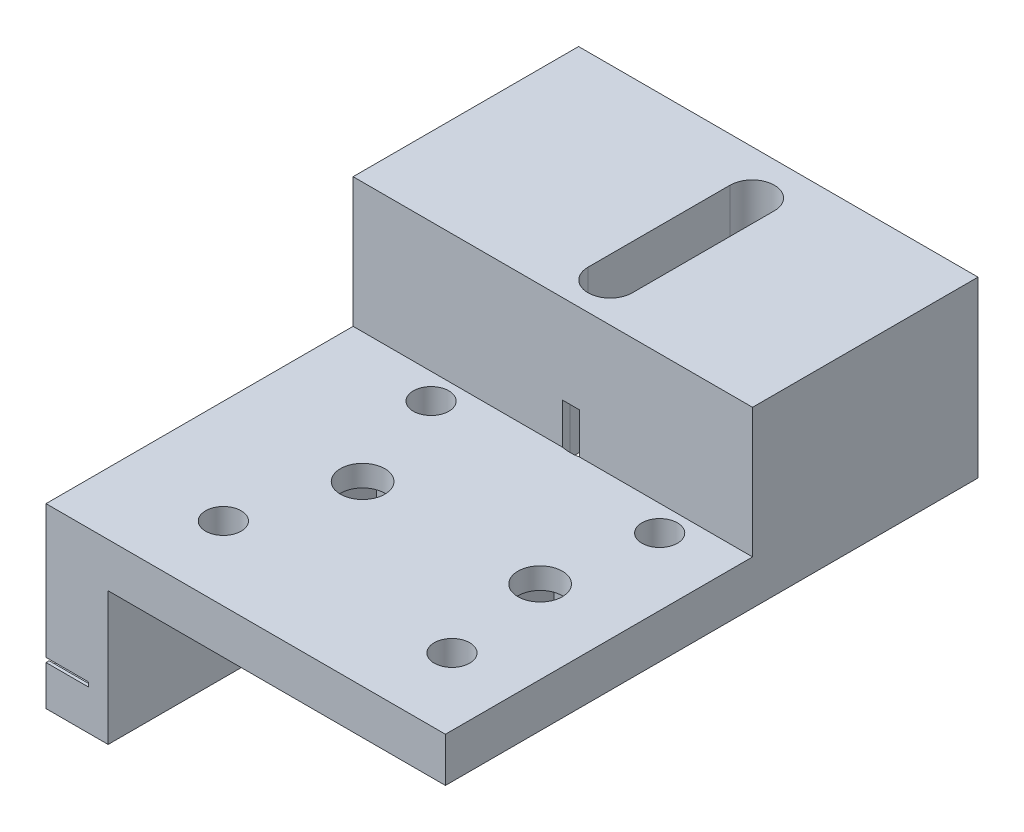
from build123d import *

# Parameters (mm, degrees)
BOSS_EXTRUDE1_DEPTH = 50.8
SKETCH2_R           = 2.54
CUT_EXTRUDE1_DEPTH  = 6.35
CUT_EXTRUDE5_DEPTH  = 3.302
SKETCH5_R           = 3.175
CUT_EXTRUDE6_DEPTH  = 79.801427652
CUT_EXTRUDE7_DEPTH  = 6.096
CRVPATTERN1_DEPTH   = 6.096
CUT_EXTRUDE8_DEPTH  = 6.096
BOSS_EXTRUDE2_DEPTH = 25.4
SKETCH16_W          = 57.15
SKETCH16_H          = 18.542
BOSS_EXTRUDE4_DEPTH = 6.858
BOSS_EXTRUDE5_DEPTH = 8.89
CUT_EXTRUDE9_DEPTH  = 81.413768498
CUT_EXTRUDE10_DEPTH = 12.192


# Read off the part's stored shape, not the designer's step: CrvPattern1
with BuildPart() as part:
    # Sketch1 → Boss-Extrude1 (new body)
    with BuildSketch(Plane.XY):
        Polygon((8.89, -6.35), (57.15, -6.35), (57.15, 0), (0, 0), (0, -25.4), (8.89, -25.4), align=None)
    extrude(amount=BOSS_EXTRUDE1_DEPTH)

    # Sketch2 → Cut-Extrude1 (cut)
    with BuildSketch(Plane(origin=(0, 0, 0), x_dir=(1, 0, 0), z_dir=(0, 1, 0))):
        with Locations(Location((14.83780702, -10.541, 0), (0, 0, 180))):
            Circle(SKETCH2_R)
        with Locations(Location((14.83780702, -40.259, 0), (0, 0, 180))):
            Circle(SKETCH2_R)
        with Locations(Location((47.54459298, -40.259, 0), (0, 0, 180))):
            Circle(SKETCH2_R)
        with Locations(Location((47.54459298, -10.541, 0), (0, 0, 180))):
            Circle(SKETCH2_R)
    extrude(amount=-CUT_EXTRUDE1_DEPTH, mode=Mode.SUBTRACT)

    # Sketch4 → Cut-Extrude5 (cut)
    with BuildSketch(Plane.XZ.offset(6.35)):
        Polygon((48.050369343, 30.1625), (42.551108029, 30.1625), (39.801477372, 25.4), (42.551108029, 20.6375), (48.050369343, 20.6375), (50.8, 25.4), align=None)
        Polygon((22.650369343, 30.1625), (17.151108029, 30.1625), (14.401477372, 25.4), (17.151108029, 20.6375), (22.650369343, 20.6375), (25.4, 25.4), align=None)
    extrude(amount=-CUT_EXTRUDE5_DEPTH, mode=Mode.SUBTRACT)

    # Sketch5 → Cut-Extrude6 (cut, through all)
    with BuildSketch(Plane.XZ.offset(6.35)):
        with Locations(Location((19.900738686, 25.4, 0), (0, 0, 270))):
            Circle(SKETCH5_R)
        with Locations(Location((45.300738686, 25.4, 0), (0, 0, 270))):
            Circle(SKETCH5_R)
    extrude(amount=-CUT_EXTRUDE6_DEPTH, mode=Mode.SUBTRACT)

    # Sketch7 → Cut-Extrude7 (cut)
    with BuildSketch(Plane.ZY):
        with BuildLine():
            Line((0.4445, -19.8882), (0.4445, -19.685))
            Line((0.4445, -19.685), (0, -19.685))
            Line((0, -19.685), (0, -19.05))
            Line((0, -19.05), (2.0574, -19.05))
            Line((2.0574, -19.05), (2.0574, -19.685))
            Line((2.0574, -19.685), (1.6129, -19.685))
            Line((1.6129, -19.685), (1.6129, -19.8882))
            ThreePointArc((1.6129, -19.8882), (1.0287, -20.4724), (0.4445, -19.8882))
        make_face()
    cut_extrude7 = extrude(amount=-CUT_EXTRUDE7_DEPTH, mode=Mode.SUBTRACT)

    # CrvPattern1 outline → CrvPattern1 (cut)
    with BuildSketch(Plane.YZ):
        with BuildLine():
            Line((-19.685, 2.0574), (-19.05, 2.0574))
            Line((-19.05, 2.0574), (-19.05, 5.980418122))
            Line((-19.05, 5.980418122), (-18.373992581, 7.608479924))
            Line((-18.373992581, 7.608479924), (-18.315614858, 7.564696632))
            Line((-18.315614858, 7.564696632), (-14.660941529, 12.437594403))
            Line((-14.660941529, 12.437594403), (-14.718936253, 12.481090446))
            Line((-14.718936253, 12.481090446), (-14.598542768, 12.406385274))
            Line((-14.598542768, 12.406385274), (-13.513775137, 14.154576896))
            Line((-13.513775137, 14.154576896), (-13.963773691, 14.43380479))
            Line((-13.963773691, 14.43380479), (-13.440807649, 14.350297701))
            Line((-13.440807649, 14.350297701), (-13.116392399, 16.381959461))
            Line((-13.116392399, 16.381959461), (-13.478487379, 16.439778698))
            Line((-13.478487379, 16.439778698), (-13.208, 16.439778698))
            Line((-13.208, 16.439778698), (-13.208, 18.497178698))
            Line((-13.208, 18.497178698), (-13.673230215, 18.497178698))
            Line((-13.673230215, 18.497178698), (-13.184130103, 18.66782698))
            Line((-13.184130103, 18.66782698), (-13.861893555, 20.610384949))
            Line((-13.861893555, 20.610384949), (-14.361923567, 20.435923197))
            Line((-14.361923567, 20.435923197), (-13.96824662, 20.790162349))
            Line((-13.96824662, 20.790162349), (-15.344424194, 22.319551131))
            Line((-15.344424194, 22.319551131), (-15.738101141, 21.965311979))
            Line((-15.738101141, 21.965311979), (-15.512019686, 22.444221251))
            Line((-15.512019686, 22.444221251), (-17.372526061, 23.322521195))
            Line((-17.372526061, 23.322521195), (-17.598607515, 22.843611922))
            Line((-17.598607515, 22.843611922), (-17.575291957, 23.372689705))
            Line((-17.575291957, 23.372689705), (-19.630697111, 23.463267915))
            Line((-19.630697111, 23.463267915), (-19.632451789, 23.423450674))
            Line((-19.632451789, 23.423450674), (-23.690150674, 23.423450674))
            Line((-23.690150674, 23.423450674), (-23.690150674, 22.788450674))
            Line((-23.690150674, 22.788450674), (-23.245650674, 22.788450674))
            Line((-23.245650674, 22.788450674), (-23.245650674, 22.585250674))
            ThreePointArc((-23.245650674, 22.585250674), (-22.661450674, 22.001050674), (-22.077250674, 22.585250674))
            Line((-22.077250674, 22.585250674), (-22.077250674, 22.788450674))
            Line((-22.077250674, 22.788450674), (-21.228789567, 22.788450674))
            Line((-21.228789567, 22.788450674), (-21.228789567, 22.585250674))
            ThreePointArc((-21.228789567, 22.585250674), (-20.644589567, 22.001050674), (-20.060389567, 22.585250674))
            Line((-20.060389567, 22.585250674), (-20.060389567, 22.788450674))
            Line((-20.060389567, 22.788450674), (-19.615889567, 22.788450674))
            Line((-19.615889567, 22.788450674), (-19.615889567, 22.826999081))
            Line((-19.615889567, 22.826999081), (-19.214584334, 22.809314242))
            Line((-19.214584334, 22.809314242), (-19.22353033, 22.606311264))
            ThreePointArc((-19.22353033, 22.606311264), (-18.665616507, 21.996957963), (-18.056263206, 22.554871786))
            Line((-18.056263206, 22.554871786), (-18.047317209, 22.757874764))
            Line((-18.047317209, 22.757874764), (-17.624431574, 22.739238913))
            Line((-17.624431574, 22.739238913), (-17.241645036, 22.558534671))
            Line((-17.241645036, 22.558534671), (-17.32839071, 22.374780955))
            ThreePointArc((-17.32839071, 22.374780955), (-17.049492587, 21.597095211), (-16.271806843, 21.875993333))
            Line((-16.271806843, 21.875993333), (-16.185061169, 22.059747049))
            Line((-16.185061169, 22.059747049), (-15.802274632, 21.879042808))
            Line((-15.802274632, 21.879042808), (-15.519135453, 21.564381464))
            Line((-15.519135453, 21.564381464), (-15.670186197, 21.428462691))
            ThreePointArc((-15.670186197, 21.428462691), (-15.713690614, 20.603425331), (-14.888653254, 20.559920914))
            Line((-14.888653254, 20.559920914), (-14.73760251, 20.695839687))
            Line((-14.73760251, 20.695839687), (-14.454463331, 20.381178343))
            Line((-14.454463331, 20.381178343), (-14.315018109, 19.981510248))
            Line((-14.315018109, 19.981510248), (-14.506875686, 19.914570648))
            ThreePointArc((-14.506875686, 19.914570648), (-14.86601487, 19.170528762), (-14.121972984, 18.811389579))
            Line((-14.121972984, 18.811389579), (-13.930115407, 18.87832918))
            Line((-13.930115407, 18.87832918), (-13.797131028, 18.497178698))
            Line((-13.797131028, 18.497178698), (-13.843, 18.497178698))
            Line((-13.843, 18.497178698), (-13.843, 18.052678698))
            Line((-13.843, 18.052678698), (-14.0462, 18.052678698))
            ThreePointArc((-14.0462, 18.052678698), (-14.6304, 17.468478698), (-14.0462, 16.884278698))
            Line((-14.0462, 16.884278698), (-13.843, 16.884278698))
            Line((-13.843, 16.884278698), (-13.843, 16.439778698))
            Line((-13.843, 16.439778698), (-13.750204377, 16.439778698))
            Line((-13.750204377, 16.439778698), (-13.813538212, 16.043148355))
            Line((-13.813538212, 16.043148355), (-14.014196164, 16.075189367))
            ThreePointArc((-14.014196164, 16.075189367), (-14.683205685, 15.590415667), (-14.198431985, 14.921406146))
            Line((-14.198431985, 14.921406146), (-13.997774033, 14.889365134))
            Line((-13.997774033, 14.889365134), (-14.064520265, 14.47136454))
            Line((-14.064520265, 14.47136454), (-14.28770383, 14.111685999))
            Line((-14.28770383, 14.111685999), (-14.46036473, 14.218823543))
            ThreePointArc((-14.46036473, 14.218823543), (-15.264785259, 14.030443892), (-15.076405607, 13.226023363))
            Line((-15.076405607, 13.226023363), (-14.903744706, 13.118885819))
            Line((-14.903744706, 13.118885819), (-15.115123817, 12.778231119))
            Line((-15.115123817, 12.778231119), (-15.168941529, 12.818594403))
            Line((-15.168941529, 12.818594403), (-15.435641529, 12.462994403))
            Line((-15.435641529, 12.462994403), (-15.598201529, 12.584914403))
            ThreePointArc((-15.598201529, 12.584914403), (-16.416081529, 12.468074403), (-16.299241529, 11.650194403))
            Line((-16.299241529, 11.650194403), (-16.136681529, 11.528274403))
            Line((-16.136681529, 11.528274403), (-16.645758193, 10.849505517))
            Line((-16.645758193, 10.849505517), (-16.808318193, 10.971425517))
            ThreePointArc((-16.808318193, 10.971425517), (-17.626198193, 10.854585517), (-17.509358193, 10.036705517))
            Line((-17.509358193, 10.036705517), (-17.346798193, 9.914785517))
            Line((-17.346798193, 9.914785517), (-17.855874858, 9.236016632))
            Line((-17.855874858, 9.236016632), (-18.018434858, 9.357936632))
            ThreePointArc((-18.018434858, 9.357936632), (-18.836314858, 9.241096632), (-18.719474858, 8.423216632))
            Line((-18.719474858, 8.423216632), (-18.556914858, 8.301296632))
            Line((-18.556914858, 8.301296632), (-18.806727113, 7.968213625))
            Line((-18.806727113, 7.968213625), (-18.896679007, 8.005563649))
            Line((-18.896679007, 8.005563649), (-19.067135158, 7.595045744))
            Line((-19.067135158, 7.595045744), (-19.254800486, 7.672968556))
            ThreePointArc((-19.254800486, 7.672968556), (-20.01836639, 7.357458823), (-19.702856656, 6.59389292))
            Line((-19.702856656, 6.59389292), (-19.515191328, 6.515970108))
            Line((-19.515191328, 6.515970108), (-19.68564748, 6.105452203))
            Line((-19.68564748, 6.105452203), (-19.651135866, 6.091122214))
            Line((-19.651135866, 6.091122214), (-19.685, 6.091122214))
            Line((-19.685, 6.091122214), (-19.685, 5.646622214))
            Line((-19.685, 5.646622214), (-19.8882, 5.646622214))
            ThreePointArc((-19.8882, 5.646622214), (-20.4724, 5.062422214), (-19.8882, 4.478222214))
            Line((-19.8882, 4.478222214), (-19.685, 4.478222214))
            Line((-19.685, 4.478222214), (-19.685, 3.629761107))
            Line((-19.685, 3.629761107), (-19.8882, 3.629761107))
            ThreePointArc((-19.8882, 3.629761107), (-20.4724, 3.045561107), (-19.8882, 2.461361107))
            Line((-19.8882, 2.461361107), (-19.685, 2.461361107))
            Line((-19.685, 2.461361107), (-19.685, 2.0574))
        make_face()
    crvpattern1 = extrude(amount=CRVPATTERN1_DEPTH, mode=Mode.SUBTRACT)

    # Sketch11 → Cut-Extrude8 (cut)
    with BuildSketch(Plane.ZY):
        with BuildLine():
            Line((8.423216632, -18.719474858), (8.317537925, -17.750983888))
            ThreePointArc((8.317537925, -17.750983888), (6.848546399, -18.563037732), (5.242235315, -19.05))
            ThreePointArc((5.242235315, -19.05), (6.435031757, -19.172073655), (7.63400715, -19.160967822))
            ThreePointArc((7.63400715, -19.160967822), (8.03132719, -18.945075188), (8.423216632, -18.719474858))
        make_face()
        with BuildLine():
            Line((12.523954403, -15.516921529), (11.931965147, -15.040163471))
            ThreePointArc((11.931965147, -15.040163471), (12.494096338, -14.462417188), (13.152940264, -13.997974591))
            ThreePointArc((13.152940264, -13.997974591), (14.042164022, -13.521010928), (15.033320312, -13.331742766))
            Line((15.033320312, -13.331742766), (14.893879306, -14.026044196))
            Line((14.893879306, -14.026044196), (14.165254771, -14.37403428))
            Line((14.165254771, -14.37403428), (13.172454591, -14.990075157))
            ThreePointArc((13.172454591, -14.990075157), (12.826987005, -15.227381531), (12.523954403, -15.516921529))
        make_face()
        with BuildLine():
            ThreePointArc((16.059168861, -13.913867188), (16.473780055, -13.874027022), (16.884278698, -13.9446))
            ThreePointArc((16.884278698, -13.9446), (17.164862334, -13.572777973), (17.409917203, -13.176637963))
            ThreePointArc((17.409917203, -13.176637963), (16.707293366, -13.066158726), (16.00466953, -13.176637963))
            ThreePointArc((16.00466953, -13.176637963), (15.919964776, -13.553528754), (16.059168861, -13.913867188))
        make_face()
        with BuildLine():
            ThreePointArc((18.052678698, -13.9446), (18.454488118, -13.929694509), (18.844859379, -14.026044196))
            ThreePointArc((18.844859379, -14.026044196), (19.090919959, -13.731436573), (19.148975646, -13.352004105))
            ThreePointArc((19.148975646, -13.352004105), (18.645433582, -13.161987263), (18.109718728, -13.213665166))
            ThreePointArc((18.109718728, -13.213665166), (18.0139472, -13.573884471), (18.052678698, -13.9446))
        make_face()
        with BuildLine():
            ThreePointArc((19.948040448, -14.410946897), (20.332171551, -14.537303573), (20.6278803, -14.813127882))
            ThreePointArc((20.6278803, -14.813127882), (20.993444693, -14.653558658), (21.139105274, -14.282233118))
            ThreePointArc((21.139105274, -14.282233118), (20.695591572, -13.884590982), (20.131018449, -13.694641355))
            ThreePointArc((20.131018449, -13.694641355), (20.020431485, -14.047915611), (19.948040448, -14.410946897))
        make_face()
        with BuildLine():
            ThreePointArc((22.127052648, -15.171209836), (22.523362292, -15.565812513), (22.717254454, -16.090387041))
            ThreePointArc((22.717254454, -16.090387041), (22.347028841, -16.1836569), (21.967870191, -16.228434006))
            ThreePointArc((21.967870191, -16.228434006), (21.767660423, -15.885129219), (21.496422078, -15.594660825))
            ThreePointArc((21.496422078, -15.594660825), (21.74010439, -15.27625488), (22.127052648, -15.171209836))
        make_face()
        with BuildLine():
            ThreePointArc((23.15830642, -17.02466923), (23.403664133, -17.546061839), (23.396793623, -18.12225925))
            ThreePointArc((23.396793623, -18.12225925), (23.008304311, -18.279084185), (22.656373275, -18.051790207))
            ThreePointArc((22.656373275, -18.051790207), (22.63133205, -17.675788379), (22.485320755, -17.32839071))
            ThreePointArc((22.485320755, -17.32839071), (22.742858738, -17.001581917), (23.15830642, -17.02466923))
        make_face()
    cut_extrude8 = extrude(amount=-CUT_EXTRUDE8_DEPTH, mode=Mode.SUBTRACT)

    # Mirror1: Cut-Extrude7, CrvPattern1, Cut-Extrude8 across plane
    add(cut_extrude7.mirror(Plane(origin=(0, 0, 25.4), x_dir=(1, 0, 0), z_dir=(0, 0, -1))), mode=Mode.SUBTRACT)
    add(crvpattern1.mirror(Plane(origin=(0, 0, 25.4), x_dir=(1, 0, 0), z_dir=(0, 0, -1))), mode=Mode.SUBTRACT)
    add(cut_extrude8.mirror(Plane(origin=(0, 0, 25.4), x_dir=(1, 0, 0), z_dir=(0, 0, -1))), mode=Mode.SUBTRACT)

    # Sketch12 → Boss-Extrude2 (add)
    with BuildSketch(Plane.XY):
        Polygon((8.89, -6.35), (0, -6.35), (0, 0), (0, 18.542), (57.15, 18.542), (57.15, 0), (57.15, -6.35), align=None)
    extrude(amount=-BOSS_EXTRUDE2_DEPTH)

    # Sketch16 → Boss-Extrude4 (add)
    with BuildSketch(Plane.XY):
        with Locations((28.575, 9.271)):
            Rectangle(SKETCH16_W, SKETCH16_H)
    extrude(amount=BOSS_EXTRUDE4_DEPTH)

    # Sketch17 → Boss-Extrude5 (add)
    with BuildSketch(Plane(origin=(0, 0, 0), x_dir=(0, 0, -1), z_dir=(1, 0, 0))):
        Polygon((0, -17.78), (25.4, -6.35), (0, -6.35), align=None)
    extrude(amount=BOSS_EXTRUDE5_DEPTH)

    # Sketch13 → Cut-Extrude9 (cut, through all)
    with BuildSketch(Plane(origin=(0, -6.35, 0), x_dir=(-1, 0, 0), z_dir=(0, -1, 0))):
        with BuildLine():
            Line((-28.0162, 19.05), (-28.0162, -1.27))
            ThreePointArc((-28.0162, -1.27), (-31.1912, -4.445), (-34.3662, -1.27))
            Line((-34.3662, -1.27), (-34.3662, 19.05))
            ThreePointArc((-34.3662, 19.05), (-31.1912, 22.225), (-28.0162, 19.05))
        make_face()
    extrude(amount=-CUT_EXTRUDE9_DEPTH, mode=Mode.SUBTRACT)

    # Sketch14 → Cut-Extrude10 (cut)
    with BuildSketch(Plane.XZ.offset(6.35)):
        with BuildLine():
            Line((36.9062, -19.05), (36.9062, 1.27))
            ThreePointArc((36.9062, 1.27), (31.1912, 6.985), (25.4762, 1.27))
            Line((25.4762, 1.27), (25.4762, -19.05))
            ThreePointArc((25.4762, -19.05), (31.1912, -24.765), (36.9062, -19.05))
        make_face()
    extrude(amount=-CUT_EXTRUDE10_DEPTH, mode=Mode.SUBTRACT)


solid = part.part
